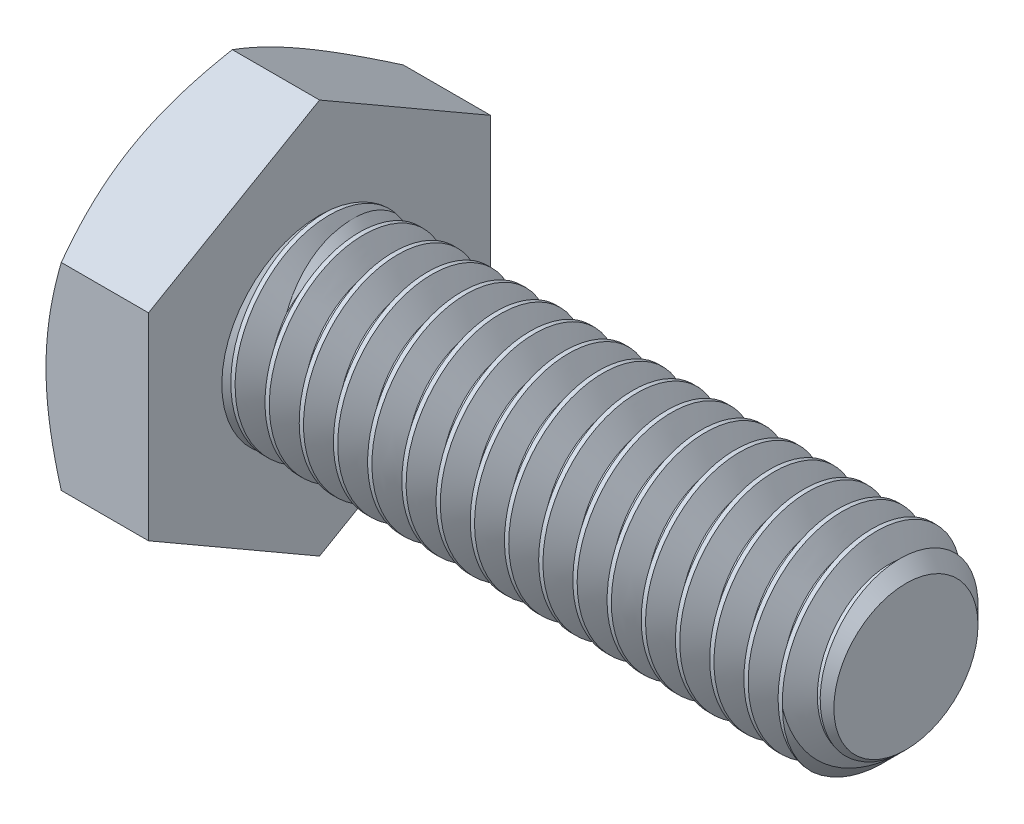
from build123d import *

# Parameters (mm, degrees)
BOSS_EXTRUDE1_START = 7.15
SKETCH2_R           = 2
BOSS_EXTRUDE1_DEPTH = 12
CHAMFER1_SIZE       = 0.525
BOSS_EXTRUDE2_START = 7.15
BOSS_EXTRUDE2_DEPTH = 2.3
SKETCH6_OUTSIDE_W   = 68.92
SKETCH6_OUTSIDE_H   = 70.002
SKETCH6_OUTSIDE_R   = 3.15
CUT_EXTRUDE1_DEPTH  = 16.266739447
CUT_EXTRUDE1_DRAFT  = -60
CUT_SWEEP1_PITCH    = 0.7
CUT_SWEEP1_TO       = 12


with BuildPart() as part:
    # Sketch2 → Boss-Extrude1 (new body)
    with BuildSketch(Plane(origin=(0, 0, 0), x_dir=(0, 0, -1), z_dir=(1, 0, 0)).offset(BOSS_EXTRUDE1_START)):
        Circle(SKETCH2_R)
    extrude(amount=-BOSS_EXTRUDE1_DEPTH)

    # Chamfer1
    chamfer1_edges = [part.edges().sort_by_distance(p)[0] for p in [
        (7.15, 0, 2),
    ]]
    chamfer(chamfer1_edges, length=CHAMFER1_SIZE)

    # Cut-Sweep1: arcs per turn and ends read off the stored shape
    # Cut-Sweep1: the profile of Sketch5 screwed along a right-hand helix through 18.142857 turns, 6 arcs to a turn; built about Z, then put on its axis
    cut_sweep1_z = Axis((0, 0, 0), (0, 0, 1))
    cut_sweep1_corners = [(1.545336663, 0, -0.35), (2.037888611, 0, -0.634375), (2.037888611, 0, 0.021875), (1.545336663, 0, -0.2625)]
    with BuildLine(mode=Mode.PRIVATE) as cut_sweep1_profile:
        Line(cut_sweep1_corners[0], cut_sweep1_corners[1])
        Line(cut_sweep1_corners[1], cut_sweep1_corners[2])
        Line(cut_sweep1_corners[2], cut_sweep1_corners[3])
        Line(cut_sweep1_corners[3], cut_sweep1_corners[0])
    cut_sweep1_cap = Face(cut_sweep1_profile.wire())
    cut_sweep1_turn_angles = [0, 30, 60, 90, 120, 150, 180, 210, 240, 270, 300, 330, 360]
    cut_sweep1_turn_weights = [1, 0.8660254037844387, 1, 0.8660254037844387, 1, 0.8660254037844387, 1, 0.8660254037844387, 1, 0.8660254037844387, 1, 0.8660254037844387, 1]
    cut_sweep1_turn_rails = [Edge.make_bspline([Vector(p[0], p[1], 0).rotate(cut_sweep1_z, cut_sweep1_turn_angles[k]) / cut_sweep1_turn_weights[k] + Vector(0, 0, p[2] + CUT_SWEEP1_PITCH * cut_sweep1_turn_angles[k] / 360) for k in range(13)], [0, 0, 0, 1, 1, 2, 2, 3, 3, 4, 4, 5, 5, 6, 6, 6], 2, cut_sweep1_turn_weights) for p in cut_sweep1_corners]
    cut_sweep1_turn_sides = [Face.make_surface_from_curves(cut_sweep1_turn_rails[p[0]], cut_sweep1_turn_rails[p[1]]) for p in [(0, 1), (1, 2), (2, 3), (3, 0)]]
    cut_sweep1_last_angles = [6480, 6505.714285714, 6531.428571429]
    cut_sweep1_last_weights = [1, 0.9009688679026391, 1]
    cut_sweep1_last_rails = [Edge.make_bspline([Vector(p[0], p[1], 0).rotate(cut_sweep1_z, cut_sweep1_last_angles[k]) / cut_sweep1_last_weights[k] + Vector(0, 0, p[2] + CUT_SWEEP1_PITCH * cut_sweep1_last_angles[k] / 360) for k in range(3)], [0, 0, 0, 1, 1, 1], 2, cut_sweep1_last_weights) for p in cut_sweep1_corners]
    cut_sweep1_last_sides = [Face.make_surface_from_curves(cut_sweep1_last_rails[p[0]], cut_sweep1_last_rails[p[1]]) for p in [(0, 1), (1, 2), (2, 3), (3, 0)]]
    cut_sweep1 = Plane(origin=(7.15, 0, 0), x_dir=(0, 1, 0), z_dir=(-1, 0, 0)) * split(Solid(Shell([*[p.moved(Location((0, 0, CUT_SWEEP1_PITCH * i))) for i in range(18) for p in cut_sweep1_turn_sides], *cut_sweep1_last_sides, cut_sweep1_cap, cut_sweep1_cap.rotate(cut_sweep1_z, 6531.428571429).moved(Location((0, 0, CUT_SWEEP1_PITCH * 6531.428571429 / 360)))])), bisect_by=Plane.XY.offset(CUT_SWEEP1_TO), keep=Keep.BOTTOM, mode=Mode.PRIVATE)
    add(cut_sweep1, mode=Mode.SUBTRACT)



with BuildPart() as body_2:
    # Sketch3 → Boss-Extrude2 (new body)
    with BuildSketch(Plane.ZY.offset(BOSS_EXTRUDE2_START)):
        Polygon((3.5, 2.020725942), (0, 4.041451884), (-3.5, 2.020725942), (-3.5, -2.020725942), (0, -4.041451884), (3.5, -2.020725942), align=None)
    extrude(amount=-BOSS_EXTRUDE2_DEPTH)


with BuildPart() as cut_extrude1_tool:
    # Sketch6 outside → Cut-Extrude1 (with draft: the straight prism first)
    with BuildSketch(Plane.ZY.offset(7.15)):
        Rectangle(SKETCH6_OUTSIDE_W, SKETCH6_OUTSIDE_H)
        Circle(SKETCH6_OUTSIDE_R, mode=Mode.SUBTRACT)
    extrude(amount=-CUT_EXTRUDE1_DEPTH)
    # Cut-Extrude1: the draft: its side faces are tilted about the plane it starts from
    cut_extrude1_sides = [cut_extrude1_tool.faces().sort_by_distance(p)[0] for p in [
        (0.983369723, -35.001, 0),
        (0.983369723, 0, 34.46),
        (0.983369723, 35.001, 0),
        (0.983369723, 0, -34.46),
        (0.983369723, 0, -3.15),
    ]]
    draft(cut_extrude1_sides, Plane.ZY.offset(7.15), CUT_EXTRUDE1_DRAFT)


with BuildPart() as body_2_1:
    add(body_2.part)

    # Cut-Extrude1: cut by cut_extrude1_tool
    add(cut_extrude1_tool.part, mode=Mode.SUBTRACT)


with BuildPart() as part_1:
    add(part.part)

    add(body_2_1.part)  # Boss-Extrude3 merges body 2
    # Boss-Extrude3: read off the stored shape, not the designer's step
    # Boss-Extrude3 outline → Boss-Extrude3 (revolve)
    with BuildSketch(Plane.YX):
        Polygon((2, -4.85), (1.545332348, -4.395332348), (1.545332348, -4.85), align=None)
    revolve(axis=Axis((0, 0, 0), (1, 0, 0)))


solid = part_1.part
